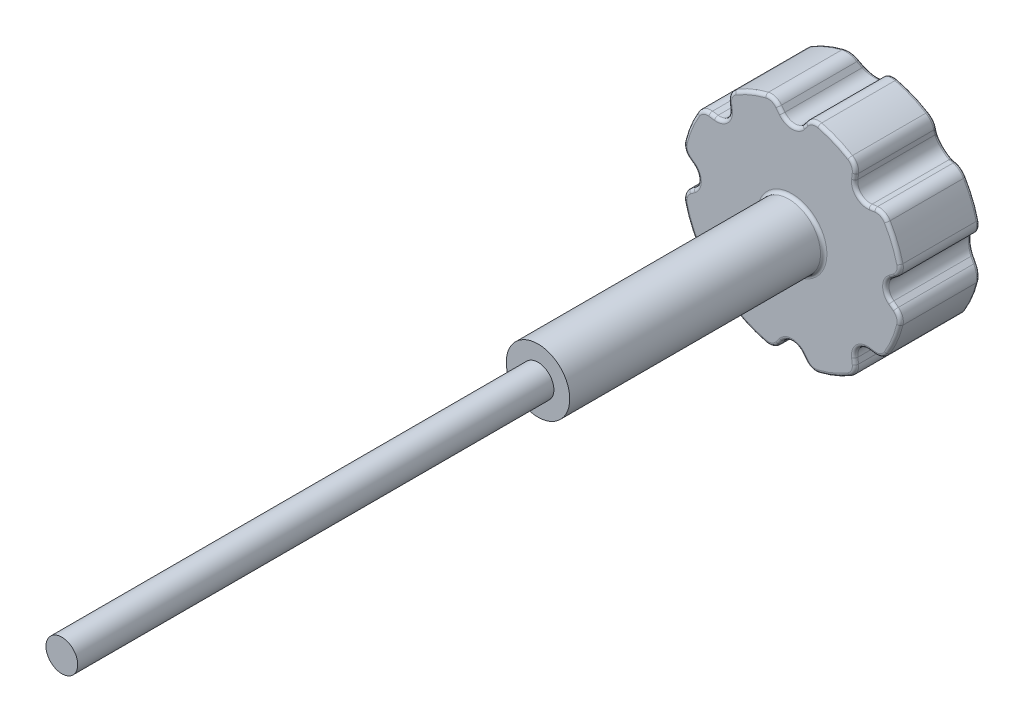
from build123d import *

# Parameters (mm, degrees)
SKETCH1_R           = 1
BOSS_EXTRUDE1_DEPTH = 8
SKETCH2_R           = 0.5
BOSS_EXTRUDE2_DEPTH = 15
SKETCH3_R           = 3.5
BOSS_EXTRUDE3_DEPTH = 2.75
CHAMFER1_SIZE       = 0.75
CHAMFER1_SIZE2      = 0.272977676
CUT_EXTRUDE1_DEPTH  = 2.75
CIRPATTERN1_COUNT   = 8
FILLET1_START       = -2.75
FILLET1_DEPTH       = 2.75
FILLET2_R           = 0.4
FILLET3_R           = 0.1
BOSS_EXTRUDE4_DEPTH = 0.25
FILLET4_R           = 0.1


with BuildPart() as part:
    # Sketch1 → Boss-Extrude1 (new body)
    with BuildSketch(Plane.XY):
        Circle(SKETCH1_R)
    extrude(amount=BOSS_EXTRUDE1_DEPTH)

    # Sketch2 → Boss-Extrude2 (add)
    with BuildSketch(Plane.XY.offset(8)):
        Circle(SKETCH2_R)
    extrude(amount=BOSS_EXTRUDE2_DEPTH)

    # Sketch3 → Boss-Extrude3 (add)
    with BuildSketch(Plane(origin=(0, 0, 0), x_dir=(-1, 0, 0), z_dir=(0, 0, -1))):
        Circle(SKETCH3_R)
    extrude(amount=BOSS_EXTRUDE3_DEPTH)

    # Chamfer1
    chamfer1_edges = [part.edges().sort_by_distance(p)[0] for p in [
        (3.5, 0, -2.75),
    ]]
    chamfer1_side = [part.faces().sort_by_distance(p)[0] for p in [
        (0, 0, -2.75),
    ]]
    chamfer(chamfer1_edges, length=CHAMFER1_SIZE, length2=CHAMFER1_SIZE2, reference=chamfer1_side[0])

    # Sketch4 → Cut-Extrude1 (cut)
    with BuildSketch(Plane(origin=(0, 0, -2.75), x_dir=(-1, 0, 0), z_dir=(0, 0, -1))):
        Polygon((-1, 4), (0, 2.7), (1, 4), align=None)
    cut_extrude1 = extrude(amount=-CUT_EXTRUDE1_DEPTH, mode=Mode.SUBTRACT)

    # CirPattern1: Cut-Extrude1 ×8 about axis
    cirpattern1_axis = Axis((0, 0, 0), (0, 0, 1))
    for i in range(1, CIRPATTERN1_COUNT):
        add(cut_extrude1.rotate(cirpattern1_axis, i * 360 / CIRPATTERN1_COUNT), mode=Mode.SUBTRACT)

    # Fillet1: read off the stored shape, not the designer's step
    # Fillet1 outline → Fillet1 (add)
    with BuildSketch(Plane.XY.offset(FILLET1_START)):
        with BuildLine():
            ThreePointArc((1.976444685, -2.424820523), (2.090242137, -2.090242137), (2.424820523, -1.976444685))
            Line((2.424820523, -1.976444685), (1.909188309, -1.909188309))
            Line((1.909188309, -1.909188309), (1.976444685, -2.424820523))
        make_face()
        with BuildLine():
            ThreePointArc((-0.317049596, -3.112164474), (0, -2.956048779), (0.317049596, -3.112164474))
            Line((0.317049596, -3.112164474), (0, -2.7))
            Line((0, -2.7), (-0.317049596, -3.112164474))
        make_face()
        with BuildLine():
            ThreePointArc((-2.424820523, -1.976444685), (-2.090242137, -2.090242137), (-1.976444685, -2.424820523))
            Line((-1.976444685, -2.424820523), (-1.909188309, -1.909188309))
            Line((-1.909188309, -1.909188309), (-2.424820523, -1.976444685))
        make_face()
        with BuildLine():
            ThreePointArc((-3.112164474, 0.317049596), (-2.956048779, 0), (-3.112164474, -0.317049596))
            Line((-3.112164474, -0.317049596), (-2.7, 0))
            Line((-2.7, 0), (-3.112164474, 0.317049596))
        make_face()
        with BuildLine():
            ThreePointArc((-1.976444685, 2.424820523), (-2.090242137, 2.090242137), (-2.424820523, 1.976444685))
            Line((-2.424820523, 1.976444685), (-1.909188309, 1.909188309))
            Line((-1.909188309, 1.909188309), (-1.976444685, 2.424820523))
        make_face()
        with BuildLine():
            ThreePointArc((0.317049596, 3.112164474), (0, 2.956048779), (-0.317049596, 3.112164474))
            Line((-0.317049596, 3.112164474), (0, 2.7))
            Line((0, 2.7), (0.317049596, 3.112164474))
        make_face()
        with BuildLine():
            ThreePointArc((3.112164474, -0.317049596), (2.956048779, 0), (3.112164474, 0.317049596))
            Line((3.112164474, 0.317049596), (2.7, 0))
            Line((2.7, 0), (3.112164474, -0.317049596))
        make_face()
        with BuildLine():
            ThreePointArc((2.424820523, 1.976444685), (2.090242137, 2.090242137), (1.976444685, 2.424820523))
            Line((1.976444685, 2.424820523), (1.909188309, 1.909188309))
            Line((1.909188309, 1.909188309), (2.424820523, 1.976444685))
        make_face()
    extrude(amount=FILLET1_DEPTH)

    # Fillet1 2 outline → Fillet1 2 (revolve, cut)
    with BuildSketch(Plane.XZ):
        Polygon((3.500000002, -2.477022324), (2.75, -2.75), (3.500000002, -2.75), align=None)
    revolve(axis=Axis((0, 0, 0), (0, 0, 1)), mode=Mode.SUBTRACT)

    # Fillet2
    fillet2_edges = [part.edges().sort_by_distance(p)[0] for p in [
        (-3.451881732, -0.578370563, -1.238511162),
        (-3.451881732, 0.578370563, -1.238511162),
        (-2.031879233, 2.849818728, -1.238511162),
        (-2.849818728, 2.031879233, -1.238511162),
        (-0.578370563, 3.451881732, -1.238511162),
        (0.578370563, 3.451881732, -1.238511162),
        (2.031879233, 2.849818728, -1.238511162),
        (2.849818728, 2.031879233, -1.238511162),
        (3.451881732, 0.578370563, -1.238511162),
        (2.849818728, -2.031879233, -1.238511162),
        (3.451881732, -0.578370563, -1.238511162),
        (2.031879233, -2.849818728, -1.238511162),
        (0.578370563, -3.451881732, -1.238511162),
        (-0.578370563, -3.451881732, -1.238511162),
        (-2.031879233, -2.849818728, -1.238511162),
        (-2.849818728, -2.031879233, -1.238511162),
    ]]
    fillet(fillet2_edges, radius=FILLET2_R)

    # Fillet3
    fillet3_edges = [part.edges().sort_by_distance(p)[0] for p in [
        (2.513266238, -1.987981083, 0),
        (2.513299896, -1.987985473, -2.584578802),
        (0.371432696, -3.182862504, 0),
        (0.371453391, -3.182889408, -2.584578802),
        (-1.987981083, -2.513266238, 0),
        (-1.987985473, -2.513299896, -2.584578802),
        (-3.182862504, -0.371432696, 0),
        (-3.182889408, -0.371453391, -2.584578802),
        (-2.513266238, 1.987981083, 0),
        (-2.513299896, 1.987985473, -2.584578802),
        (-0.371432696, 3.182862504, 0),
        (-0.371453391, 3.182889408, -2.584578802),
        (3.182862504, 0.371432696, 0),
        (3.182889408, 0.371453391, -2.584578802),
        (-2.75, 0, -2.75),
        (1.987981083, 2.513266238, 0),
        (1.987985473, 2.513299896, -2.584578802),
        (2.090242137, -2.090242137, -2.675004378),
        (2.090242137, -2.090242137, 0),
        (0, -2.956048779, -2.675004378),
        (0, -2.956048779, 0),
        (-2.090242137, -2.090242137, -2.675004378),
        (-2.090242137, -2.090242137, 0),
        (-2.956048779, 0, -2.675004378),
        (-2.956048779, 0, 0),
        (-2.090242137, 2.090242137, -2.675004378),
        (-2.090242137, 2.090242137, 0),
        (0, 2.956048779, -2.675004378),
        (0, 2.956048779, 0),
        (2.956048779, 0, -2.675004378),
        (2.956048779, 0, 0),
        (2.090242137, 2.090242137, -2.675004378),
        (2.090242137, 2.090242137, 0),
        (-3.233578364, -1.339392013, -2.477022324),
        (-3.233578364, -1.339392013, 0),
        (2.513299896, 1.987985473, -2.584578802),
        (3.233578364, 1.339392013, -2.477022324),
        (3.182889408, -0.371453391, -2.584578802),
        (3.233578364, -1.339392013, -2.477022324),
        (1.987985473, -2.513299896, -2.584578802),
        (1.339392013, -3.233578364, -2.477022324),
        (-0.371453391, -3.182889408, -2.584578802),
        (-1.339392013, -3.233578364, -2.477022324),
        (-2.513299896, -1.987985473, -2.584578802),
        (-3.182889408, 0.371453391, -2.584578802),
        (-3.233578364, 1.339392013, -2.477022324),
        (-1.987985473, 2.513299896, -2.584578802),
        (-1.339392013, 3.233578364, -2.477022324),
        (0.371453391, 3.182889408, -2.584578802),
        (1.339392013, 3.233578364, -2.477022324),
        (-2.824283347, -1.964561118, -2.49872952),
        (-1.964561118, -2.824283347, -2.49872952),
        (-0.607915418, -3.386224395, -2.49872952),
        (0.607915418, -3.386224395, -2.49872952),
        (1.964561118, -2.824283347, -2.49872952),
        (3.386224395, -0.607915418, -2.49872952),
        (2.824283347, -1.964561118, -2.49872952),
        (3.386224396, 0.607915418, -2.49872952),
        (2.824283347, 1.964561118, -2.49872952),
        (1.964561119, 2.824283347, -2.49872952),
        (0.607915418, 3.386224396, -2.49872952),
        (-0.607915418, 3.386224395, -2.49872952),
        (-2.824283347, 1.964561118, -2.49872952),
        (-1.964561118, 2.824283347, -2.49872952),
        (-3.386224395, 0.607915418, -2.49872952),
        (-3.386224395, -0.607915418, -2.49872952),
        (2.513266238, 1.987981083, 0),
        (1.339392013, 3.233578364, 0),
        (0.371432696, 3.182862504, 0),
        (-1.339392013, 3.233578364, 0),
        (-1.987981083, 2.513266238, 0),
        (-3.233578364, 1.339392013, 0),
        (-3.182862504, 0.371432696, 0),
        (-2.513266238, -1.987981083, 0),
        (-1.339392013, -3.233578364, 0),
        (-0.371432696, -3.182862504, 0),
        (1.339392013, -3.233578364, 0),
        (1.987981083, -2.513266238, 0),
        (3.233578364, -1.339392013, 0),
        (3.182862504, -0.371432696, 0),
        (3.233578364, 1.339392013, 0),
        (-2.827016722, -1.96325735, 0),
        (-1.96325735, -2.827016722, 0),
        (-0.610770109, -3.38723528, 0),
        (0.610770109, -3.38723528, 0),
        (1.96325735, -2.827016722, 0),
        (3.38723528, -0.610770109, 0),
        (2.827016722, -1.96325735, 0),
        (3.38723528, 0.610770109, 0),
        (2.827016722, 1.96325735, 0),
        (1.96325735, 2.827016722, 0),
        (0.610770109, 3.38723528, 0),
        (-0.610770109, 3.38723528, 0),
        (-2.827016722, 1.96325735, 0),
        (-1.96325735, 2.827016722, 0),
        (-3.38723528, 0.610770109, 0),
        (-3.38723528, -0.610770109, 0),
        (-1, 0, 0),
    ]]
    fillet(fillet3_edges, radius=FILLET3_R)

    # Sketch5 → Boss-Extrude4 (add)
    with BuildSketch(Plane(origin=(0, 0, -2.75), x_dir=(-1, 0, 0), z_dir=(0, 0, -1))):
        Polygon((-1.25, 1.1), (1.25, 1.1), (1.25, 0.4), (0.35, 0.4), (0.35, -1.5), (-0.35, -1.5), (-0.35, 0.4), (-1.25, 0.4), align=None)
    extrude(amount=BOSS_EXTRUDE4_DEPTH)

    # Fillet4
    fillet4_edges = [part.edges().sort_by_distance(p)[0] for p in [
        (1.25, 0.75, -2.75),
        (1.25, 1.1, -2.875),
        (0.8, 0.4, -2.75),
        (1.25, 0.4, -2.875),
        (0.35, -0.55, -2.75),
        (0.35, 0.4, -2.875),
        (0, -1.5, -2.75),
        (0.35, -1.5, -2.875),
        (-0.35, -0.55, -2.75),
        (-0.35, -1.5, -2.875),
        (-0.8, 0.4, -2.75),
        (-0.35, 0.4, -2.875),
        (-1.25, 0.75, -2.75),
        (-1.25, 0.4, -2.875),
        (0, 1.1, -2.75),
        (-1.25, 1.1, -2.875),
        (1.25, 0.75, -3),
        (0.8, 0.4, -3),
        (0.35, -0.55, -3),
        (0, -1.5, -3),
        (-0.35, -0.55, -3),
        (-0.8, 0.4, -3),
        (-1.25, 0.75, -3),
        (0, 1.1, -3),
    ]]
    fillet(fillet4_edges, radius=FILLET4_R)


solid = part.part
